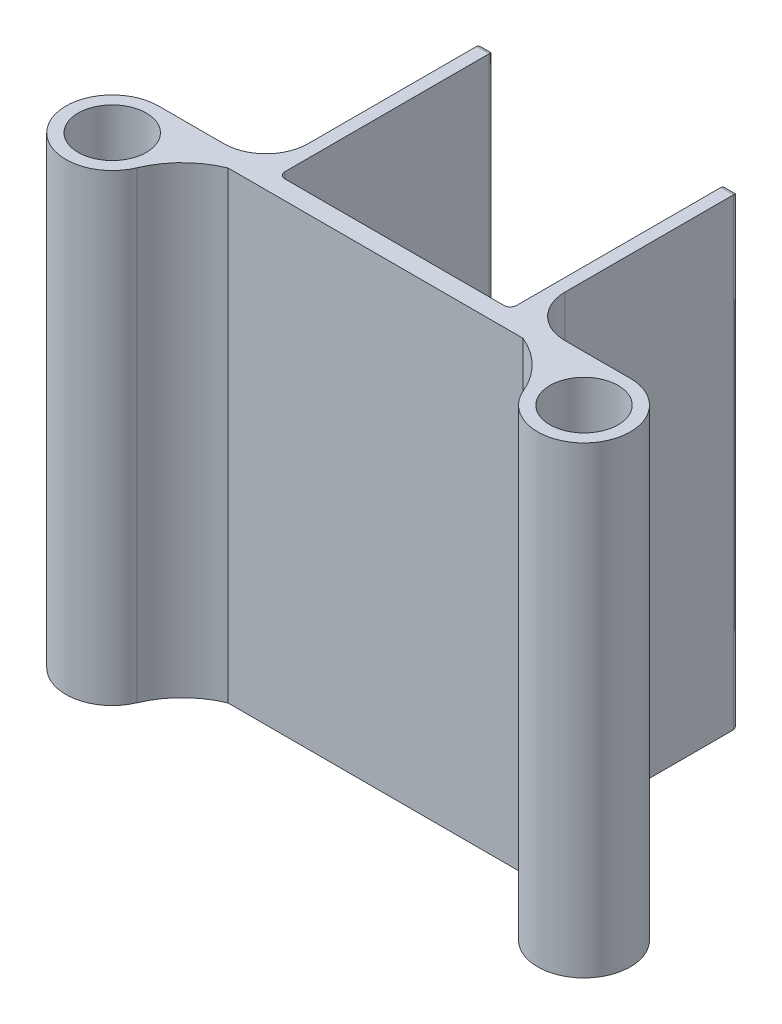
from build123d import *

# Parameters (mm, degrees)
SKETCH1_R              = 8
BOSS_EXTRUDE1_DEPTH    = 130
FILLET1_R              = 20
SKETCH2_W              = 2
SKETCH2_H              = 130
BOSS_EXTRUDE4_DEPTH    = 30
CUT_EXTRUDE1_DEPTH     = 9
FILLET2_R              = 1
FILLET3_R              = 2
CUT_EXTRUDE2_START     = -11
CUT_EXTRUDE2_OUTLINE_W = 137
CUT_EXTRUDE2_OUTLINE_H = 54
CUT_EXTRUDE2_DEPTH     = 11
CUT_EXTRUDE3_DEPTH     = 50
SKETCH6_W              = 87.560859394
SKETCH6_H              = 110.580871242
SKETCH6_RX             = 28
SKETCH6_RY             = 6.639736886
SKETCH6_RY_2           = 5.950557319
BOSS_EXTRUDE7_DEPTH    = 1.5
SKETCH7_W              = 87.560859394
SKETCH7_H              = 1.5
CUT_EXTRUDE4_DEPTH     = 0.290435621
SKETCH8_W              = 87.560859394
SKETCH8_H              = 1.5
CUT_EXTRUDE5_DEPTH     = 0.290435621
SKETCH9_R              = 113.429913181
CUT_EXTRUDE6_DEPTH     = 135
SKETCH10_W             = 60.632055489
SKETCH10_H             = 78.176650268
BOSS_EXTRUDE8_DEPTH    = 4.5
SKETCH11_R             = 8.1
CUT_EXTRUDE7_DEPTH     = 135
SKETCH12_W             = 3
SKETCH12_H             = 110
BOSS_EXTRUDE9_DEPTH    = 51
FILLET4_R              = 10
FILLET5_R              = 1.5
FILLET7_R              = 1


# Read off the part's stored shape, not the designer's step: Cut-Extrude2
with BuildPart() as part:
    # Sketch1 → Boss-Extrude1 (new body)
    with BuildSketch(Plane(origin=(0, 0, 0), x_dir=(1, 0, 0), z_dir=(0, 1, 0))):
        with BuildLine():
            ThreePointArc((-62.734857267, 11), (-66.796876469, -10.22252415), (-55.185022832, 8))
            Line((-55.185022832, 8), (41.715308298, 8))
            ThreePointArc((41.715308298, 8), (53.327161935, -10.22252415), (49.265142733, 11))
            Line((49.265142733, 11), (-62.734857267, 11))
        make_face()
        with Locations(Location((-62.734857267, 0, 0), (0, 0, 270))):
            Circle(SKETCH1_R, mode=Mode.SUBTRACT)
        with Locations(Location((49.265142733, 0, 0), (0, 0, 270))):
            Circle(SKETCH1_R, mode=Mode.SUBTRACT)
    extrude(amount=BOSS_EXTRUDE1_DEPTH)

    # Fillet1
    fillet1_edges = [part.edges().sort_by_distance(p)[0] for p in [
        (41.715308298, 65, -8),
        (-55.185022832, 65, -8),
    ]]
    fillet(fillet1_edges, radius=FILLET1_R)

    # Sketch2 → Boss-Extrude4 (add)
    with BuildSketch(Plane(origin=(0, 0, -11), x_dir=(-1, 0, 0), z_dir=(0, 0, -1))):
        with Locations((7.734857267, 65)):
            Rectangle(SKETCH2_W, SKETCH2_H)
        with Locations((5.734857267, 65)):
            Rectangle(SKETCH2_W, SKETCH2_H)
    extrude(amount=BOSS_EXTRUDE4_DEPTH)

    # Sketch3 → Cut-Extrude1 (cut)
    with BuildSketch(Plane(origin=(0, 130, 0), x_dir=(1, 0, 0), z_dir=(0, 1, 0))):
        with BuildLine():
            Line((-34.151645411, 8), (20.681930877, 8))
            ThreePointArc((20.681930877, 8), (31.753545265, 4.655910508), (39.12271272, -4.258064516))
            ThreePointArc((39.12271272, -4.258064516), (58.425893512, -6.089387914), (49.265142733, 11))
            Line((49.265142733, 11), (-4.734857267, 11))
            Line((-4.734857267, 11), (-4.734857267, 41))
            Line((-4.734857267, 41), (-8.734857267, 41))
            Line((-8.734857267, 41), (-8.734857267, 11))
            Line((-8.734857267, 11), (-62.734857267, 11))
            ThreePointArc((-62.734857267, 11), (-71.895608046, -6.089387914), (-52.592427254, -4.258064516))
            ThreePointArc((-52.592427254, -4.258064516), (-45.223259799, 4.655910508), (-34.151645411, 8))
        make_face()
    extrude(amount=-CUT_EXTRUDE1_DEPTH, mode=Mode.SUBTRACT)

    # Fillet2
    fillet2_edges = [part.edges().sort_by_distance(p)[0] for p in [
        (-8.734857267, 60.5, -11),
        (-4.734857267, 60.5, -11),
    ]]
    fillet(fillet2_edges, radius=FILLET2_R)

    # Fillet3
    fillet3_edges = [part.edges().sort_by_distance(p)[0] for p in [
        (-4.734857267, 60.5, -41),
        (-8.734857267, 60.5, -41),
    ]]
    fillet(fillet3_edges, radius=FILLET3_R - 0.0001)  # a hair under: the kernel refuses the full size

    # Cut-Extrude2 outline → Cut-Extrude2 (cut)
    with BuildSketch(Plane.XZ.offset(CUT_EXTRUDE2_START)):
        with Locations((-6.5, -15)):
            Rectangle(CUT_EXTRUDE2_OUTLINE_W, CUT_EXTRUDE2_OUTLINE_H)
    extrude(amount=CUT_EXTRUDE2_DEPTH, mode=Mode.SUBTRACT)

    # Sketch5 → Cut-Extrude3 (cut)
    with BuildSketch(Plane(origin=(0, 0, -11), x_dir=(-1, 0, 0), z_dir=(0, 0, -1))):
        with BuildLine():
            add(Edge.make_bspline(
                [(27.082988225, 66), (27.082988225, 94), (20.443251339, 94)],
                knots=[1.570796327, 1.570796327, 1.570796327, 3.141592654, 3.141592654, 3.141592654], degree=2, weights=[1, 0.707106781, 1]))
            Line((20.443251339, 94), (20.443251339, 66))
            Line((20.443251339, 66), (27.082988225, 66))
        make_face()
        with BuildLine():
            Line((20.443251339, 66), (20.443251339, 94))
            add(Edge.make_bspline(
                [(20.443251339, 94), (13.803514453, 94), (13.803514453, 66)],
                knots=[3.141592654, 3.141592654, 3.141592654, 4.71238898, 4.71238898, 4.71238898], degree=2, weights=[1, 0.707106781, 1]))
            Line((13.803514453, 66), (20.443251339, 66))
        make_face()
        with BuildLine():
            Line((20.443251339, 66), (13.803514453, 66))
            add(Edge.make_bspline(
                [(13.803514453, 66), (13.803514453, 38), (20.443251339, 38)],
                knots=[4.71238898, 4.71238898, 4.71238898, 6.283185307, 6.283185307, 6.283185307], degree=2, weights=[1, 0.707106781, 1]))
            add(Edge.make_bspline(
                [(20.443251339, 38), (27.082988225, 38), (27.082988225, 66)],
                knots=[0, 0, 0, 1.570796327, 1.570796327, 1.570796327], degree=2, weights=[1, 0.707106781, 1]))
            Line((27.082988225, 66), (20.443251339, 66))
        make_face()
        with BuildLine():
            Line((-1.022979486, 66), (-6.973536805, 66))
            Line((-6.973536805, 66), (-12.924094124, 66))
            add(Edge.make_bspline(
                [(-12.924094124, 66), (-12.924094124, 38), (-6.973536805, 38)],
                knots=[4.71238898, 4.71238898, 4.71238898, 6.283185307, 6.283185307, 6.283185307], degree=2, weights=[1, 0.707106781, 1]))
            add(Edge.make_bspline(
                [(-6.973536805, 38), (-1.022979486, 38), (-1.022979486, 66)],
                knots=[0, 0, 0, 1.570796327, 1.570796327, 1.570796327], degree=2, weights=[1, 0.707106781, 1]))
        make_face()
        with BuildLine():
            add(Edge.make_bspline(
                [(-1.022979486, 66), (-1.022979486, 94), (-6.973536805, 94)],
                knots=[1.570796327, 1.570796327, 1.570796327, 3.141592654, 3.141592654, 3.141592654], degree=2, weights=[1, 0.707106781, 1]))
            Line((-6.973536805, 94), (-6.973536805, 66))
            Line((-6.973536805, 66), (-1.022979486, 66))
        make_face()
        with BuildLine():
            Line((-6.973536805, 66), (-6.973536805, 94))
            add(Edge.make_bspline(
                [(-6.973536805, 94), (-12.924094124, 94), (-12.924094124, 66)],
                knots=[3.141592654, 3.141592654, 3.141592654, 4.71238898, 4.71238898, 4.71238898], degree=2, weights=[1, 0.707106781, 1]))
            Line((-12.924094124, 66), (-6.973536805, 66))
        make_face()
    extrude(amount=-CUT_EXTRUDE3_DEPTH, mode=Mode.SUBTRACT)

    # Sketch6 → Boss-Extrude7 (add)
    with BuildSketch(Plane.XY.offset(-8)):
        with Locations((-6.734857267, 66)):
            Rectangle(SKETCH6_W, SKETCH6_H)
        with Locations(Location((-20.443251339, 66), (0, 0, -90))):
            Ellipse(SKETCH6_RX, SKETCH6_RY, mode=Mode.SUBTRACT)
        with Locations(Location((6.973536805, 66), (0, 0, -90))):
            Ellipse(SKETCH6_RX, SKETCH6_RY_2, mode=Mode.SUBTRACT)
    extrude(amount=BOSS_EXTRUDE7_DEPTH)

    # Sketch7 → Cut-Extrude4 (cut)
    with BuildSketch(Plane(origin=(0, 121.290435621, 0), x_dir=(1, 0, 0), z_dir=(0, 1, 0))):
        with Locations((-6.734857267, 7.25)):
            Rectangle(SKETCH7_W, SKETCH7_H)
    extrude(amount=-CUT_EXTRUDE4_DEPTH, mode=Mode.SUBTRACT)

    # Sketch8 → Cut-Extrude5 (cut)
    with BuildSketch(Plane.XZ.offset(-10.709564379)):
        with Locations((-6.734857267, -7.25)):
            Rectangle(SKETCH8_W, SKETCH8_H)
    extrude(amount=-CUT_EXTRUDE5_DEPTH, mode=Mode.SUBTRACT)

    # Sketch9 → Cut-Extrude6 (cut)
    with BuildSketch(Plane(origin=(0, 0, -11), x_dir=(-1, 0, 0), z_dir=(0, 0, -1))):
        with Locations((15.997363152, 101.645153737)):
            Circle(SKETCH9_R)
    extrude(amount=CUT_EXTRUDE6_DEPTH, mode=Mode.SUBTRACT)

    # Sketch10 → Boss-Extrude8 (add)
    with BuildSketch(Plane(origin=(0, 0, -11), x_dir=(-1, 0, 0), z_dir=(0, 0, -1))):
        with Locations((5.573817907, 65.992517727)):
            Rectangle(SKETCH10_W, SKETCH10_H)
    extrude(amount=-BOSS_EXTRUDE8_DEPTH)

    # Sketch11 → Cut-Extrude7 (cut)
    with BuildSketch(Plane.XZ.offset(-11)):
        with Locations(Location((-62.734857267, 0, 0), (0, 0, 270))):
            Circle(SKETCH11_R)
        with Locations(Location((49.265142733, 0, 0), (0, 0, 270))):
            Circle(SKETCH11_R)
    extrude(amount=-CUT_EXTRUDE7_DEPTH, mode=Mode.SUBTRACT)

    # Sketch12 → Boss-Extrude9 (add)
    with BuildSketch(Plane(origin=(0, 0, -11), x_dir=(-1, 0, 0), z_dir=(0, 0, -1))):
        with Locations((-22.265142733, 66)):
            Rectangle(SKETCH12_W, SKETCH12_H)
        with Locations((35.734857267, 66)):
            Rectangle(SKETCH12_W, SKETCH12_H)
    extrude(amount=BOSS_EXTRUDE9_DEPTH)

    # Fillet4
    fillet4_edges = [part.edges().sort_by_distance(p)[0] for p in [
        (23.765142733, 66, -11),
        (-37.234857267, 66, -11),
    ]]
    fillet(fillet4_edges, radius=FILLET4_R)

    # Fillet5
    fillet5_edges = [part.edges().sort_by_distance(p)[0] for p in [
        (20.765142733, 66, -11),
        (-34.234857267, 66, -11),
    ]]
    fillet(fillet5_edges, radius=FILLET5_R)

    # Fillet7
    fillet7_edges = [part.edges().sort_by_distance(p)[0] for p in [
        (23.765142733, 66, -62),
        (22.265142733, 11, -62),
        (20.765142733, 66, -62),
        (22.265142733, 121, -62),
        (-37.234857267, 66, -62),
        (-35.734857267, 121, -62),
        (-34.234857267, 66, -62),
        (-35.734857267, 11, -62),
    ]]
    fillet(fillet7_edges, radius=FILLET7_R)


solid = part.part
